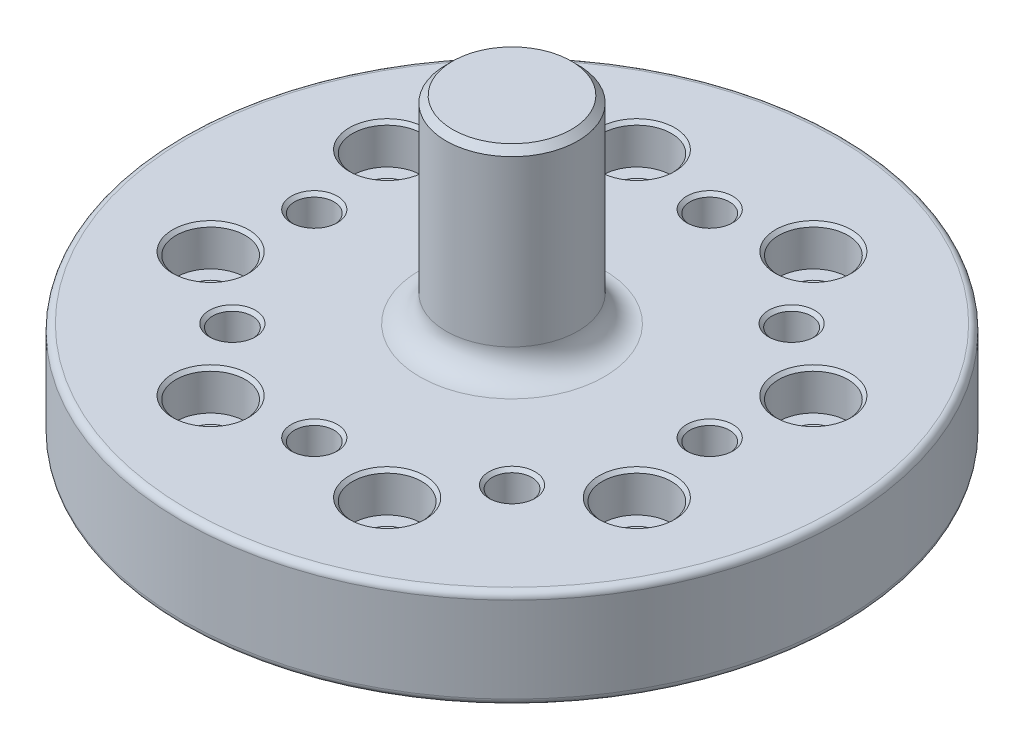
from build123d import *

# Parameters (mm, degrees)
SKETCH1_R                    = 50
BOSS_EXTRUDE1_DEPTH          = 15
SKETCH2_R                    = 3
CUT_EXTRUDE1_DEPTH           = 73.284161474
CIRPATTERN1_COUNT            = 8
SKETCH3_R                    = 10
BOSS_EXTRUDE2_DEPTH          = 30
FILLET1_R                    = 4
FILLET2_R                    = 1
CHAMFER1_SIZE                = 0.5
SKETCH4_R                    = 2.65
CUT_EXTRUDE2_DEPTH           = 77.811457544
SKETCH5_R                    = 5.25
CUT_EXTRUDE3_DEPTH           = 6
CHAMFER2_SIZE                = 0.5
CIRPATTERN2_COUNT            = 8
CHAMFER2_OF_CIRPATTERN2_SIZE = 0.5
CHAMFER3_SIZE                = 1


with BuildPart() as part:
    # Sketch1 → Boss-Extrude1 (new body)
    with BuildSketch(Plane(origin=(0, 0, 0), x_dir=(1, 0, 0), z_dir=(0, 1, 0))):
        Circle(SKETCH1_R)
    extrude(amount=BOSS_EXTRUDE1_DEPTH)

    # Sketch2 → Cut-Extrude1 (cut, through all)
    with BuildSketch(Plane(origin=(0, 15, 0), x_dir=(1, 0, 0), z_dir=(0, 1, 0))):
        with Locations((-30, 0)):
            Circle(SKETCH2_R)
    cut_extrude1 = extrude(amount=-CUT_EXTRUDE1_DEPTH, mode=Mode.SUBTRACT)

    # CirPattern1: Cut-Extrude1 ×8 about axis
    cirpattern1_axis = Axis((0, 15, 0), (0, 1, 0))
    for i in range(1, CIRPATTERN1_COUNT):
        add(cut_extrude1.rotate(cirpattern1_axis, i * 360 / CIRPATTERN1_COUNT), mode=Mode.SUBTRACT)

    # Sketch3 → Boss-Extrude2 (add)
    with BuildSketch(Plane(origin=(0, 15, 0), x_dir=(1, 0, 0), z_dir=(0, 1, 0))):
        Circle(SKETCH3_R)
    extrude(amount=BOSS_EXTRUDE2_DEPTH)

    # Fillet1
    fillet1_edges = [part.edges().sort_by_distance(p)[0] for p in [
        (-10, 15, 0),
    ]]
    fillet(fillet1_edges, radius=FILLET1_R)

    # Fillet2
    fillet2_edges = [part.edges().sort_by_distance(p)[0] for p in [
        (-50, 0, 0),
        (-50, 15, 0),
    ]]
    fillet(fillet2_edges, radius=FILLET2_R)

    # Chamfer1
    chamfer1_edges = [part.edges().sort_by_distance(p)[0] for p in [
        (0, 0, 33),
        (23.334523779, 0, 23.334523779),
        (33, 0, 0),
        (23.334523779, 0, -23.334523779),
        (0, 0, -33),
        (-23.334523779, 0, -23.334523779),
        (-33, 0, 0),
        (-23.334523779, 0, 23.334523779),
        (-23.334523779, 15, -23.334523779),
        (0, 15, -33),
        (23.334523779, 15, -23.334523779),
        (33, 15, 0),
        (23.334523779, 15, 23.334523779),
        (0, 15, 33),
        (-33, 15, 0),
        (-23.334523779, 15, 23.334523779),
    ]]
    chamfer(chamfer1_edges, length=CHAMFER1_SIZE)

    # Sketch4 → Cut-Extrude2 (cut, through all)
    with BuildSketch(Plane(origin=(0, 15, 0), x_dir=(1, 0, 0), z_dir=(0, 1, 0))):
        with Locations((-32.335783638, 13.393920133)):
            Circle(SKETCH4_R)
    cut_extrude2 = extrude(amount=-CUT_EXTRUDE2_DEPTH, mode=Mode.SUBTRACT)

    # Sketch5 → Cut-Extrude3 (cut)
    with BuildSketch(Plane(origin=(0, 15, 0), x_dir=(1, 0, 0), z_dir=(0, 1, 0))):
        with Locations((-32.335783638, 13.393920133)):
            Circle(SKETCH5_R)
    cut_extrude3 = extrude(amount=-CUT_EXTRUDE3_DEPTH, mode=Mode.SUBTRACT)

    # Chamfer2
    chamfer2_edges = [part.edges().sort_by_distance(p)[0] for p in [
        (-34.985783638, 0, -13.393920133),
        (-37.585783638, 15, -13.393920133),
        (-34.985783638, 9, -13.393920133),
    ]]
    chamfer(chamfer2_edges, length=CHAMFER2_SIZE)

    # CirPattern2: Cut-Extrude2, Cut-Extrude3 ×8 about axis
    cirpattern2_axis = Axis((0, 15, 0), (0, 1, 0))
    add([cut_extrude2.rotate(cirpattern2_axis, i * 360 / CIRPATTERN2_COUNT) for i in range(1, CIRPATTERN2_COUNT)], mode=Mode.SUBTRACT)
    add([cut_extrude3.rotate(cirpattern2_axis, i * 360 / CIRPATTERN2_COUNT) for i in range(1, CIRPATTERN2_COUNT)], mode=Mode.SUBTRACT)

    # Chamfer2 of CirPattern2
    chamfer2_of_cirpattern2_edges = [part.edges().sort_by_distance(p)[0] for p in [
        (-34.209616608, 0, 15.267753103),
        (-36.048094239, 15, 17.106230734),
        (-34.209616608, 9, 15.267753103),
        (-13.393920133, 0, 34.985783638),
        (-13.393920133, 15, 37.585783638),
        (-13.393920133, 9, 34.985783638),
        (15.267753103, 0, 34.209616608),
        (17.106230734, 15, 36.048094239),
        (15.267753103, 9, 34.209616608),
        (34.985783638, 0, 13.393920133),
        (37.585783638, 15, 13.393920133),
        (34.985783638, 9, 13.393920133),
        (34.209616608, 0, -15.267753103),
        (36.048094239, 15, -17.106230734),
        (34.209616608, 9, -15.267753103),
        (13.393920133, 0, -34.985783638),
        (13.393920133, 15, -37.585783638),
        (13.393920133, 9, -34.985783638),
        (-15.267753103, 0, -34.209616608),
        (-17.106230734, 15, -36.048094239),
        (-15.267753103, 9, -34.209616608),
    ]]
    chamfer(chamfer2_of_cirpattern2_edges, length=CHAMFER2_OF_CIRPATTERN2_SIZE)

    # Chamfer3
    chamfer3_edges = [part.edges().sort_by_distance(p)[0] for p in [
        (-10, 45, 0),
    ]]
    chamfer(chamfer3_edges, length=CHAMFER3_SIZE)


solid = part.part
